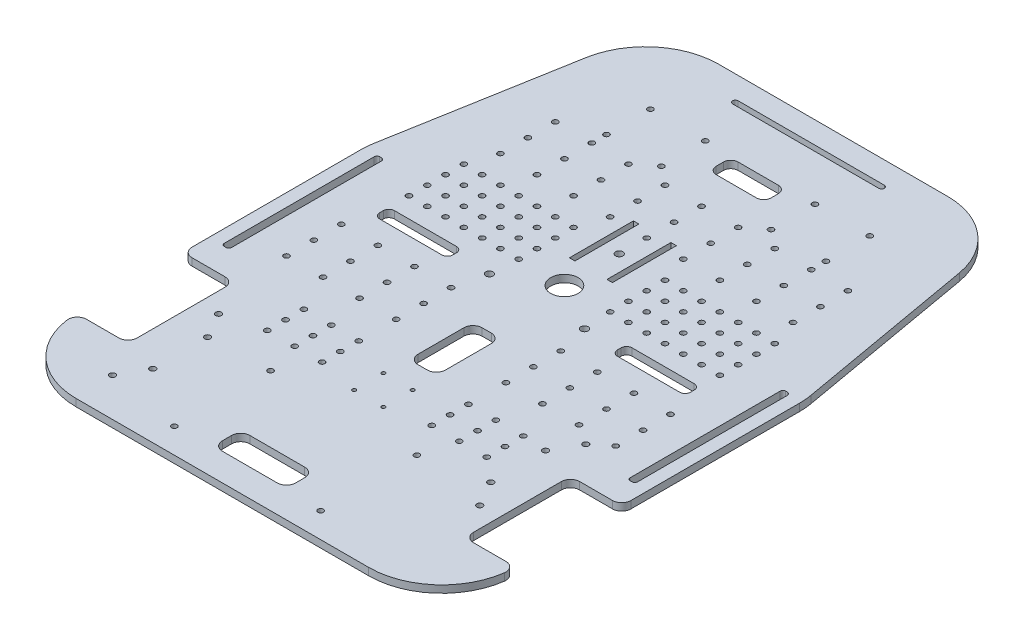
from build123d import *

# Parameters (mm, degrees)
SKETCH_1_W             = 240
SKETCH_1_H             = 334
EXTRUDE_1_DEPTH        = 4
CUT_EXTRUDE_1_DEPTH    = 4
FILLET_1_R             = 40
SKETCH_3_R             = 1.6
CUT_EXTRUDE_2_DEPTH    = 10
SKETCH_6_W             = 28
SKETCH_6_H             = 58
CUT_EXTRUDE_4_DEPTH    = 10
FILLET_2_R             = 5
SKETCH_4_R             = 1.6
CUT_EXTRUDE_3_DEPTH    = 10
SKETCH_8_R             = 1.5
CUT_EXTRUDE_5_DEPTH    = 10
SKETCH_9_R             = 1
CUT_EXTRUDE_6_DEPTH    = 10
SKETCH_11_R            = 2
SKETCH_11_R_2          = 7.5
CUT_EXTRUDE_7_DEPTH    = 10
SKETCH_12_R            = 1.5
CUT_EXTRUDE_8_DEPTH    = 10
CUT_EXTRUDE_9_DEPTH    = 10
SKETCH_14_W            = 40
SKETCH_14_H            = 15
CUT_EXTRUDE_10_DEPTH   = 10
FILLET_3_R             = 5
SKETCH_16_W            = 4
SKETCH_16_H            = 85
CUT_EXTRUDE_11_DEPTH   = 10
FILLET_4_R             = 1.5
FILLET_4_OF_MIRROR_1_R = 1.5
SKETCH_17_R            = 1.5
CUT_EXTRUDE_12_DEPTH   = 10
SKETCH_18_R            = 1.5
CUT_EXTRUDE_13_DEPTH   = 10
SKETCH_19_R            = 1.5
CUT_EXTRUDE_14_DEPTH   = 206.68179321
SKETCH_20_W            = 40
SKETCH_20_H            = 8
CUT_EXTRUDE_15_DEPTH   = 206.68179321
FILLET_5_R             = 3
SKETCH_21_W            = 15
SKETCH_21_H            = 35
CUT_EXTRUDE_16_DEPTH   = 206.68179321
FILLET_6_R             = 5
SKETCH_22_R            = 1.5
CUT_EXTRUDE_17_DEPTH   = 206.68179321
SKETCH_23_W            = 30
SKETCH_23_H            = 12
CUT_EXTRUDE_18_DEPTH   = 206.68179321
FILLET_7_R             = 4
SKETCH_24_W            = 3
SKETCH_24_H            = 35
CUT_EXTRUDE_19_DEPTH   = 206.68179321


with BuildPart() as part:
    # 草图1 → 凸台-拉伸1 (new body)
    with BuildSketch(Plane(origin=(0, 0, 0), x_dir=(1, 0, 0), z_dir=(0, 1, 0))):
        Rectangle(SKETCH_1_W, SKETCH_1_H)
    extrude(amount=EXTRUDE_1_DEPTH)

    # 草图2 → 切除-拉伸1 (cut)
    with BuildSketch(Plane(origin=(0, 4, 0), x_dir=(1, 0, 0), z_dir=(0, 1, 0))):
        Polygon((-120, 32), (-96.195857604, 167), (-120, 167), align=None)
        Polygon((120, 167), (120, 32), (96.195857604, 167), align=None)
    extrude(amount=-CUT_EXTRUDE_1_DEPTH, mode=Mode.SUBTRACT)

    # 圆角1
    fillet_1_edges = [part.edges().sort_by_distance(p)[0] for p in [
        (120, 2, -32),
        (96.195857604, 2, -167),
        (120, 2, 167),
        (-120, 2, 167),
        (-120, 2, -32),
        (-96.195857604, 2, -167),
    ]]
    fillet(fillet_1_edges, radius=FILLET_1_R)

    # 草图3 → 切除-拉伸2 (cut)
    with BuildSketch(Plane(origin=(0, 4, 0), x_dir=(1, 0, 0), z_dir=(0, 1, 0))):
        with Locations((-81.12223423, -88)):
            Circle(SKETCH_3_R)
        with Locations((-73.12223423, -102)):
            Circle(SKETCH_3_R)
        with Locations((-73.12223423, -132)):
            Circle(SKETCH_3_R)
        with Locations((-81.12223423, -146)):
            Circle(SKETCH_3_R)
    extrude(amount=-CUT_EXTRUDE_2_DEPTH, mode=Mode.SUBTRACT)

    # 草图6 → 切除-拉伸4 (cut)
    with BuildSketch(Plane(origin=(0, 4, 0), x_dir=(1, 0, 0), z_dir=(0, 1, 0))):
        with Locations((106, -97.65)):
            Rectangle(SKETCH_6_W, SKETCH_6_H)
        with Locations((-106, -97.65)):
            Rectangle(SKETCH_6_W, SKETCH_6_H)
    extrude(amount=-CUT_EXTRUDE_4_DEPTH, mode=Mode.SUBTRACT)

    # 圆角2
    fillet_2_edges = [part.edges().sort_by_distance(p)[0] for p in [
        (92, 2, 126.65),
        (92, 2, 68.65),
        (120, 2, 68.65),
        (120, 2, 126.65),
        (-120, 2, 126.65),
        (-92, 2, 126.65),
        (-92, 2, 68.65),
        (-120, 2, 68.65),
    ]]
    fillet(fillet_2_edges, radius=FILLET_2_R)

    # 草图4 → 切除-拉伸3 (cut)
    with BuildSketch(Plane(origin=(0, 4, 0), x_dir=(1, 0, 0), z_dir=(0, 1, 0))):
        with Locations((81.0184613, -49.3)):
            Circle(SKETCH_4_R)
        with Locations((73.0184613, -63.3)):
            Circle(SKETCH_4_R)
        with Locations((73.0184613, -93.3)):
            Circle(SKETCH_4_R)
        with Locations((81.0184613, -107.3)):
            Circle(SKETCH_4_R)
        with Locations((-73.12223423, -132)):
            Circle(SKETCH_4_R)
        with Locations((-73.12223423, -102)):
            Circle(SKETCH_4_R)
    extrude(amount=-CUT_EXTRUDE_3_DEPTH, mode=Mode.SUBTRACT)

    # 草图8 → 切除-拉伸5 (cut)
    with BuildSketch(Plane(origin=(0, 4, 0), x_dir=(1, 0, 0), z_dir=(0, 1, 0))):
        with Locations((-60, 127)):
            Circle(SKETCH_8_R)
        with Locations((-30, 127)):
            Circle(SKETCH_8_R)
        with Locations((-60, 103)):
            Circle(SKETCH_8_R)
        with Locations((-30, 103)):
            Circle(SKETCH_8_R)
        with Locations((30, 127)):
            Circle(SKETCH_8_R)
        with Locations((30, 103)):
            Circle(SKETCH_8_R)
        with Locations((60, 127)):
            Circle(SKETCH_8_R)
        with Locations((60, 103)):
            Circle(SKETCH_8_R)
    extrude(amount=-CUT_EXTRUDE_5_DEPTH, mode=Mode.SUBTRACT)

    # 草图9 → 切除-拉伸6 (cut)
    with BuildSketch(Plane(origin=(0, 4, 0), x_dir=(1, 0, 0), z_dir=(0, 1, 0))):
        with Locations((-8, -71)):
            Circle(SKETCH_9_R)
        with Locations((8, -71)):
            Circle(SKETCH_9_R)
        with Locations((-8, -87)):
            Circle(SKETCH_9_R)
        with Locations((8, -87)):
            Circle(SKETCH_9_R)
    extrude(amount=-CUT_EXTRUDE_6_DEPTH, mode=Mode.SUBTRACT)

    # 草图11 → 切除-拉伸7 (cut)
    with BuildSketch(Plane(origin=(0, 4, 0), x_dir=(1, 0, 0), z_dir=(0, 1, 0))):
        with Locations((0, 50)):
            Circle(SKETCH_11_R)
        with Locations((25.980762114, 5)):
            Circle(SKETCH_11_R)
        with Locations((-25.980762114, 5)):
            Circle(SKETCH_11_R)
        with Locations((0, 20)):
            Circle(SKETCH_11_R_2)
    extrude(amount=-CUT_EXTRUDE_7_DEPTH, mode=Mode.SUBTRACT)

    # 草图12 → 切除-拉伸8 (cut)
    with BuildSketch(Plane(origin=(0, 4, 0), x_dir=(1, 0, 0), z_dir=(0, 1, 0))):
        with Locations((40, -100.691)):
            Circle(SKETCH_12_R)
        with Locations((40, -153.309)):
            Circle(SKETCH_12_R)
        with Locations((-40, -100.691)):
            Circle(SKETCH_12_R)
        with Locations((-40, -153.309)):
            Circle(SKETCH_12_R)
    extrude(amount=-CUT_EXTRUDE_8_DEPTH, mode=Mode.SUBTRACT)

    # 草图13 → 切除-拉伸9 (cut)
    with BuildSketch(Plane(origin=(0, 4, 0), x_dir=(1, 0, 0), z_dir=(0, 1, 0))):
        with BuildLine():
            Line((-40, 155), (40, 155))
            ThreePointArc((40, 155), (41.5, 153.5), (40, 152))
            Line((40, 152), (-40, 152))
            ThreePointArc((-40, 152), (-41.5, 153.5), (-40, 155))
        make_face()
    extrude(amount=-CUT_EXTRUDE_9_DEPTH, mode=Mode.SUBTRACT)

    # 草图14 → 切除-拉伸10 (cut)
    with BuildSketch(Plane(origin=(0, 4, 0), x_dir=(1, 0, 0), z_dir=(0, 1, 0))):
        with Locations((0, -144.5)):
            Rectangle(SKETCH_14_W, SKETCH_14_H)
    extrude(amount=-CUT_EXTRUDE_10_DEPTH, mode=Mode.SUBTRACT)

    # 圆角3
    fillet_3_edges = [part.edges().sort_by_distance(p)[0] for p in [
        (20, 2, 152),
        (-20, 2, 152),
        (20, 2, 137),
        (-20, 2, 137),
    ]]
    fillet(fillet_3_edges, radius=FILLET_3_R)

    # 草图16 → 切除-拉伸11 (cut)
    with BuildSketch(Plane(origin=(0, 4, 0), x_dir=(1, 0, 0), z_dir=(0, 1, 0))):
        with Locations((-111, -12)):
            Rectangle(SKETCH_16_W, SKETCH_16_H)
    cut_extrude_11 = extrude(amount=-CUT_EXTRUDE_11_DEPTH, mode=Mode.SUBTRACT)

    # 圆角4
    fillet_4_edges = [part.edges().sort_by_distance(p)[0] for p in [
        (-109, 2, 54.5),
        (-113, 2, 54.5),
        (-113, 2, -30.5),
        (-109, 2, -30.5),
    ]]
    fillet(fillet_4_edges, radius=FILLET_4_R)

    # 镜向1: 切除-拉伸11 across plane
    add(cut_extrude_11.mirror(Plane(origin=(0, 0, 0), x_dir=(0, 0, 1), z_dir=(1, 0, 0))), mode=Mode.SUBTRACT)

    # 圆角4 of 镜向1
    fillet_4_of_mirror_1_edges = [part.edges().sort_by_distance(p)[0] for p in [
        (109, 2, 54.5),
        (113, 2, 54.5),
        (113, 2, -30.5),
        (109, 2, -30.5),
    ]]
    fillet(fillet_4_of_mirror_1_edges, radius=FILLET_4_OF_MIRROR_1_R)

    # 草图17 → 切除-拉伸12 (cut)
    with BuildSketch(Plane(origin=(0, 4, 0), x_dir=(1, 0, 0), z_dir=(0, 1, 0))):
        with Locations((-60, -82.5)):
            Circle(SKETCH_17_R)
        with Locations((-45, -82.5)):
            Circle(SKETCH_17_R)
        with Locations((-30, -82.5)):
            Circle(SKETCH_17_R)
        with Locations((-45, -72.5)):
            Circle(SKETCH_17_R)
        with Locations((-30, -72.5)):
            Circle(SKETCH_17_R)
        with Locations((-45, -62.5)):
            Circle(SKETCH_17_R)
        with Locations((-30, -62.5)):
            Circle(SKETCH_17_R)
        with Locations((-60, -72.5)):
            Circle(SKETCH_17_R)
        with Locations((-60, -62.5)):
            Circle(SKETCH_17_R)
    cut_extrude_12 = extrude(amount=-CUT_EXTRUDE_12_DEPTH, mode=Mode.SUBTRACT)

    # 镜向2: 切除-拉伸12 across plane
    add(cut_extrude_12.mirror(Plane(origin=(0, 0, 0), x_dir=(0, 0, 1), z_dir=(1, 0, 0))), mode=Mode.SUBTRACT)

    # 草图18 → 切除-拉伸13 (cut)
    with BuildSketch(Plane(origin=(0, 4, 0), x_dir=(1, 0, 0), z_dir=(0, 1, 0))):
        with Locations((-90, -42)):
            Circle(SKETCH_18_R)
        with Locations((-70, -42)):
            Circle(SKETCH_18_R)
        with Locations((-50, -42)):
            Circle(SKETCH_18_R)
        with Locations((-30, -42)):
            Circle(SKETCH_18_R)
        with Locations((30, -42)):
            Circle(SKETCH_18_R)
        with Locations((50, -42)):
            Circle(SKETCH_18_R)
        with Locations((70, -42)):
            Circle(SKETCH_18_R)
        with Locations((90, -42)):
            Circle(SKETCH_18_R)
        with Locations((-70, -27)):
            Circle(SKETCH_18_R)
        with Locations((-50, -27)):
            Circle(SKETCH_18_R)
        with Locations((-30, -27)):
            Circle(SKETCH_18_R)
        with Locations((30, -27)):
            Circle(SKETCH_18_R)
        with Locations((50, -27)):
            Circle(SKETCH_18_R)
        with Locations((70, -27)):
            Circle(SKETCH_18_R)
        with Locations((90, -27)):
            Circle(SKETCH_18_R)
        with Locations((-70, -12)):
            Circle(SKETCH_18_R)
        with Locations((-50, -12)):
            Circle(SKETCH_18_R)
        with Locations((-30, -12)):
            Circle(SKETCH_18_R)
        with Locations((30, -12)):
            Circle(SKETCH_18_R)
        with Locations((50, -12)):
            Circle(SKETCH_18_R)
        with Locations((70, -12)):
            Circle(SKETCH_18_R)
        with Locations((90, -12)):
            Circle(SKETCH_18_R)
        with Locations((-90, -27)):
            Circle(SKETCH_18_R)
        with Locations((-90, -12)):
            Circle(SKETCH_18_R)
    extrude(amount=-CUT_EXTRUDE_13_DEPTH, mode=Mode.SUBTRACT)

    # 草图19 → 切除-拉伸14 (cut, through all)
    with BuildSketch(Plane(origin=(0, 4, 0), x_dir=(1, 0, 0), z_dir=(0, 1, 0))):
        with Locations((-85, 20)):
            Circle(SKETCH_19_R)
        with Locations((-75, 20)):
            Circle(SKETCH_19_R)
        with Locations((-65, 20)):
            Circle(SKETCH_19_R)
        with Locations((-55, 20)):
            Circle(SKETCH_19_R)
        with Locations((-45, 20)):
            Circle(SKETCH_19_R)
        with Locations((-35, 20)):
            Circle(SKETCH_19_R)
        with Locations((-25, 20)):
            Circle(SKETCH_19_R)
        with Locations((-75, 30)):
            Circle(SKETCH_19_R)
        with Locations((-65, 30)):
            Circle(SKETCH_19_R)
        with Locations((-55, 30)):
            Circle(SKETCH_19_R)
        with Locations((-45, 30)):
            Circle(SKETCH_19_R)
        with Locations((-35, 30)):
            Circle(SKETCH_19_R)
        with Locations((-25, 30)):
            Circle(SKETCH_19_R)
        with Locations((-75, 40)):
            Circle(SKETCH_19_R)
        with Locations((-65, 40)):
            Circle(SKETCH_19_R)
        with Locations((-55, 40)):
            Circle(SKETCH_19_R)
        with Locations((-45, 40)):
            Circle(SKETCH_19_R)
        with Locations((-35, 40)):
            Circle(SKETCH_19_R)
        with Locations((-25, 40)):
            Circle(SKETCH_19_R)
        with Locations((-75, 50)):
            Circle(SKETCH_19_R)
        with Locations((-65, 50)):
            Circle(SKETCH_19_R)
        with Locations((-55, 50)):
            Circle(SKETCH_19_R)
        with Locations((-45, 50)):
            Circle(SKETCH_19_R)
        with Locations((-35, 50)):
            Circle(SKETCH_19_R)
        with Locations((-25, 50)):
            Circle(SKETCH_19_R)
        with Locations((-85, 30)):
            Circle(SKETCH_19_R)
        with Locations((-85, 40)):
            Circle(SKETCH_19_R)
        with Locations((-85, 50)):
            Circle(SKETCH_19_R)
        with Locations((85, 50)):
            Circle(SKETCH_19_R)
        with Locations((85, 40)):
            Circle(SKETCH_19_R)
        with Locations((85, 30)):
            Circle(SKETCH_19_R)
        with Locations((25, 50)):
            Circle(SKETCH_19_R)
        with Locations((35, 50)):
            Circle(SKETCH_19_R)
        with Locations((45, 50)):
            Circle(SKETCH_19_R)
        with Locations((55, 50)):
            Circle(SKETCH_19_R)
        with Locations((65, 50)):
            Circle(SKETCH_19_R)
        with Locations((75, 50)):
            Circle(SKETCH_19_R)
        with Locations((25, 40)):
            Circle(SKETCH_19_R)
        with Locations((35, 40)):
            Circle(SKETCH_19_R)
        with Locations((45, 40)):
            Circle(SKETCH_19_R)
        with Locations((55, 40)):
            Circle(SKETCH_19_R)
        with Locations((65, 40)):
            Circle(SKETCH_19_R)
        with Locations((75, 40)):
            Circle(SKETCH_19_R)
        with Locations((25, 30)):
            Circle(SKETCH_19_R)
        with Locations((35, 30)):
            Circle(SKETCH_19_R)
        with Locations((45, 30)):
            Circle(SKETCH_19_R)
        with Locations((55, 30)):
            Circle(SKETCH_19_R)
        with Locations((65, 30)):
            Circle(SKETCH_19_R)
        with Locations((75, 30)):
            Circle(SKETCH_19_R)
        with Locations((25, 20)):
            Circle(SKETCH_19_R)
        with Locations((35, 20)):
            Circle(SKETCH_19_R)
        with Locations((45, 20)):
            Circle(SKETCH_19_R)
        with Locations((55, 20)):
            Circle(SKETCH_19_R)
        with Locations((65, 20)):
            Circle(SKETCH_19_R)
        with Locations((75, 20)):
            Circle(SKETCH_19_R)
        with Locations((85, 20)):
            Circle(SKETCH_19_R)
    extrude(amount=-CUT_EXTRUDE_14_DEPTH, mode=Mode.SUBTRACT)

    # 草图20 → 切除-拉伸15 (cut, through all)
    with BuildSketch(Plane(origin=(0, 4, 0), x_dir=(1, 0, 0), z_dir=(0, 1, 0))):
        with Locations((65, 5)):
            Rectangle(SKETCH_20_W, SKETCH_20_H)
        with Locations((-65, 5)):
            Rectangle(SKETCH_20_W, SKETCH_20_H)
    extrude(amount=-CUT_EXTRUDE_15_DEPTH, mode=Mode.SUBTRACT)

    # 圆角5
    fillet_5_edges = [part.edges().sort_by_distance(p)[0] for p in [
        (45, 2, -1),
        (45, 2, -9),
        (85, 2, -9),
        (85, 2, -1),
        (-45, 2, -1),
        (-85, 2, -1),
        (-45, 2, -9),
        (-85, 2, -9),
    ]]
    fillet(fillet_5_edges, radius=FILLET_5_R)

    # 草图21 → 切除-拉伸16 (cut, through all)
    with BuildSketch(Plane(origin=(0, 4, 0), x_dir=(1, 0, 0), z_dir=(0, 1, 0))):
        with Locations((0, -40)):
            Rectangle(SKETCH_21_W, SKETCH_21_H)
    extrude(amount=-CUT_EXTRUDE_16_DEPTH, mode=Mode.SUBTRACT)

    # 圆角6
    fillet_6_edges = [part.edges().sort_by_distance(p)[0] for p in [
        (7.5, 2, 57.5),
        (-7.5, 2, 57.5),
        (-7.5, 2, 22.5),
        (7.5, 2, 22.5),
    ]]
    fillet(fillet_6_edges, radius=FILLET_6_R)

    # 草图22 → 切除-拉伸17 (cut, through all)
    with BuildSketch(Plane(origin=(0, 4, 0), x_dir=(1, 0, 0), z_dir=(0, 1, 0))):
        with Locations((-80, 65)):
            Circle(SKETCH_22_R)
        with Locations((-60, 65)):
            Circle(SKETCH_22_R)
        with Locations((-40, 65)):
            Circle(SKETCH_22_R)
        with Locations((-20, 65)):
            Circle(SKETCH_22_R)
        with Locations((0, 65)):
            Circle(SKETCH_22_R)
        with Locations((20, 65)):
            Circle(SKETCH_22_R)
        with Locations((40, 65)):
            Circle(SKETCH_22_R)
        with Locations((60, 65)):
            Circle(SKETCH_22_R)
        with Locations((80, 65)):
            Circle(SKETCH_22_R)
        with Locations((-60, 80)):
            Circle(SKETCH_22_R)
        with Locations((-40, 80)):
            Circle(SKETCH_22_R)
        with Locations((-20, 80)):
            Circle(SKETCH_22_R)
        with Locations((0, 80)):
            Circle(SKETCH_22_R)
        with Locations((20, 80)):
            Circle(SKETCH_22_R)
        with Locations((40, 80)):
            Circle(SKETCH_22_R)
        with Locations((60, 80)):
            Circle(SKETCH_22_R)
        with Locations((80, 80)):
            Circle(SKETCH_22_R)
        with Locations((-60, 95)):
            Circle(SKETCH_22_R)
        with Locations((-40, 95)):
            Circle(SKETCH_22_R)
        with Locations((-20, 95)):
            Circle(SKETCH_22_R)
        with Locations((0, 95)):
            Circle(SKETCH_22_R)
        with Locations((20, 95)):
            Circle(SKETCH_22_R)
        with Locations((40, 95)):
            Circle(SKETCH_22_R)
        with Locations((60, 95)):
            Circle(SKETCH_22_R)
        with Locations((80, 95)):
            Circle(SKETCH_22_R)
        with Locations((-80, 80)):
            Circle(SKETCH_22_R)
        with Locations((-80, 95)):
            Circle(SKETCH_22_R)
    extrude(amount=-CUT_EXTRUDE_17_DEPTH, mode=Mode.SUBTRACT)

    # 草图23 → 切除-拉伸18 (cut, through all)
    with BuildSketch(Plane(origin=(0, 4, 0), x_dir=(1, 0, 0), z_dir=(0, 1, 0))):
        with Locations((0, 120)):
            Rectangle(SKETCH_23_W, SKETCH_23_H)
    extrude(amount=-CUT_EXTRUDE_18_DEPTH, mode=Mode.SUBTRACT)

    # 圆角7
    fillet_7_edges = [part.edges().sort_by_distance(p)[0] for p in [
        (15, 2, -114),
        (15, 2, -126),
        (-15, 2, -114),
        (-15, 2, -126),
    ]]
    fillet(fillet_7_edges, radius=FILLET_7_R)

    # 草图24 → 切除-拉伸19 (cut, through all)
    with BuildSketch(Plane(origin=(0, 4, 0), x_dir=(1, 0, 0), z_dir=(0, 1, 0))):
        with Locations((-10.25, 52)):
            Rectangle(SKETCH_24_W, SKETCH_24_H)
        with Locations((10.25, 52)):
            Rectangle(SKETCH_24_W, SKETCH_24_H)
    extrude(amount=-CUT_EXTRUDE_19_DEPTH, mode=Mode.SUBTRACT)


solid = part.part
